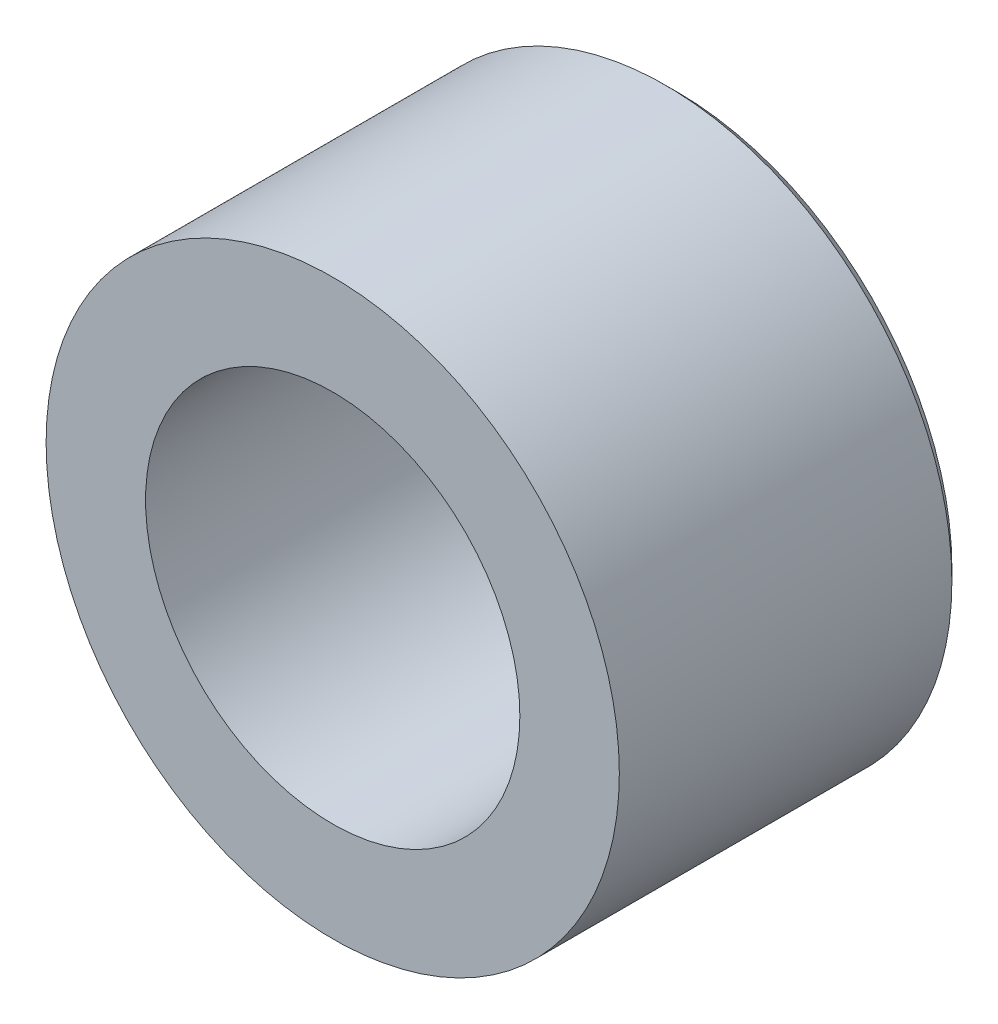
from build123d import *

# Parameters (mm, degrees)
SKETCH1_R           = 4.8625
SKETCH1_R_2         = 3.175
BOSS_EXTRUDE1_DEPTH = 5.842
CHAMFER1_SIZE       = 0.4
CHAMFER2_SIZE       = 0.2


with BuildPart() as part:
    # Sketch1 → Boss-Extrude1 (new body)
    with BuildSketch(Plane.XY):
        Circle(SKETCH1_R)
        Circle(SKETCH1_R_2, mode=Mode.SUBTRACT)
    extrude(amount=BOSS_EXTRUDE1_DEPTH)

    # Chamfer1
    chamfer1_edges = [part.edges().sort_by_distance(p)[0] for p in [
        (-3.175, 0, 0),
    ]]
    chamfer(chamfer1_edges, length=CHAMFER1_SIZE)

    # Chamfer2
    chamfer2_edges = [part.edges().sort_by_distance(p)[0] for p in [
        (-4.8625, 0, 0),
    ]]
    chamfer(chamfer2_edges, length=CHAMFER2_SIZE)


solid = part.part
